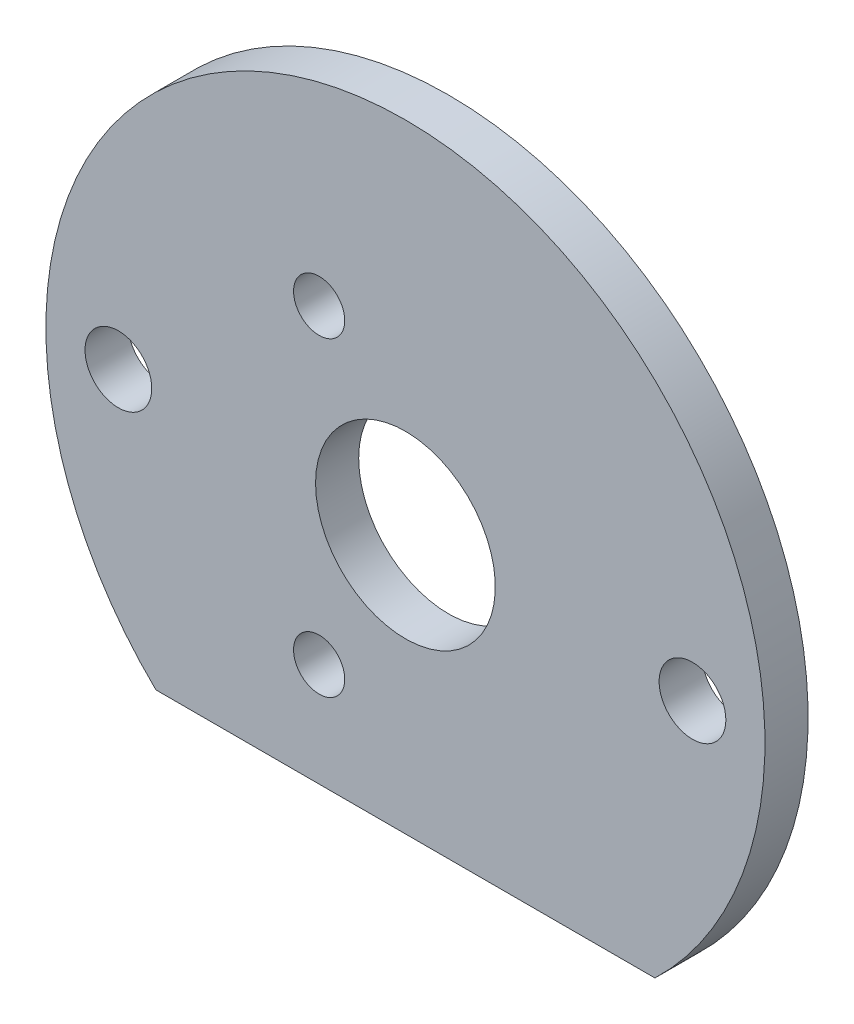
from build123d import *

# Parameters (mm, degrees)
SKETCH1_R             = 15.875
SKETCH1_R_2           = 3.96875
BOSS_EXTRUDE1_DEPTH   = 1.905
MOTORCLEARANCEHOLES_D = 2.9464
ENCODERSETSCREWS_D    = 2.2606
LINACTCUTAWAY_DEPTH   = 23.531317649


with BuildPart() as part:
    # Sketch1 → Boss-Extrude1 (new body)
    with BuildSketch(Plane.XY):
        Circle(SKETCH1_R)
        Circle(SKETCH1_R_2, mode=Mode.SUBTRACT)
    extrude(amount=BOSS_EXTRUDE1_DEPTH)

    # MotorClearanceHoles (through all)
    with Locations(Plane.XY.offset(1.905)):
        with Locations((-12.6746, 0), (12.6746, 0)):
            Hole(MOTORCLEARANCEHOLES_D / 2)

    # EncoderSetScrews (through all)
    with Locations(Plane.XY.offset(1.905)):
        with Locations((-3.81, 6.858), (-3.81, -6.858)):
            Hole(ENCODERSETSCREWS_D / 2)

    # Sketch8 → LinActCutaway (cut, through all)
    with BuildSketch(Plane.XY.offset(1.905)):
        with BuildLine():
            Line((-11.016838249, -11.43), (11.016838249, -11.43))
            ThreePointArc((11.016838249, -11.43), (0, -15.875), (-11.016838249, -11.43))
        make_face()
    extrude(amount=-LINACTCUTAWAY_DEPTH, mode=Mode.SUBTRACT)


solid = part.part
